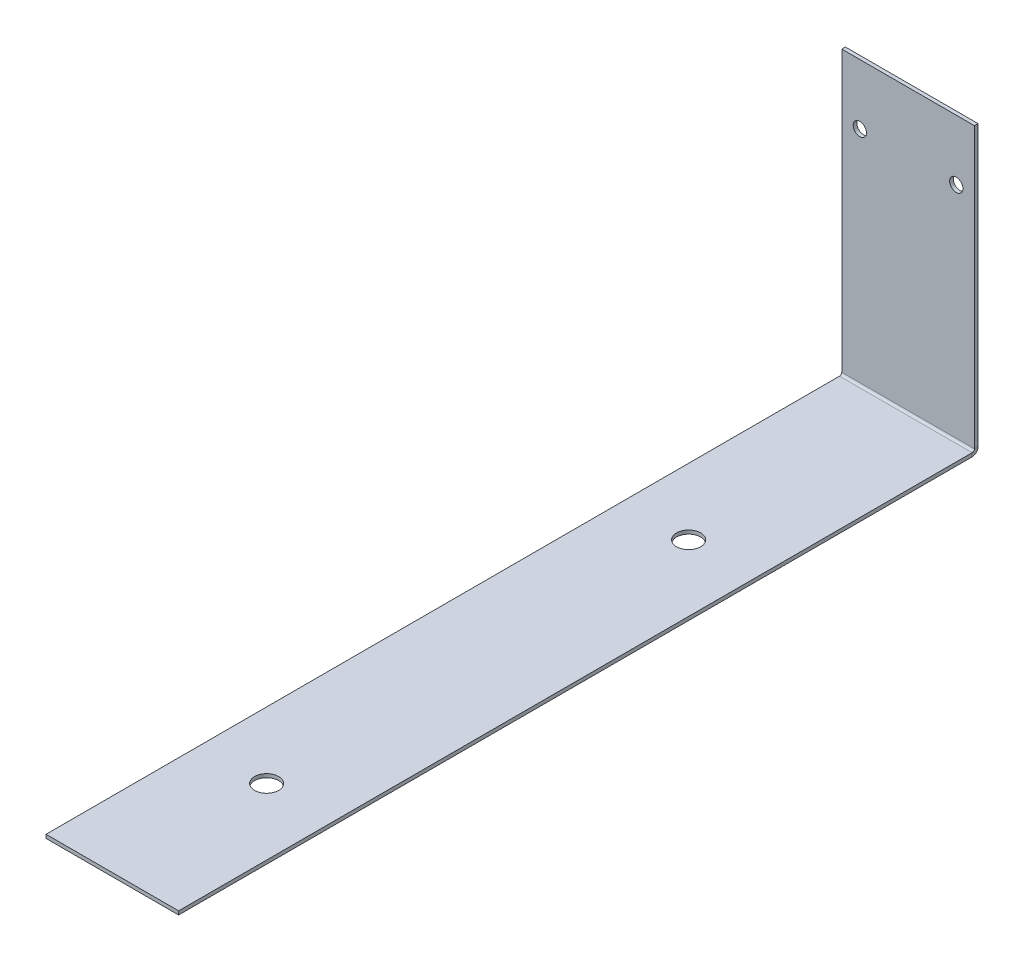
from build123d import *

# Parameters (mm, degrees)
SKETCH1_W              = 44
SKETCH1_H              = 360
BASE_FLANGE1_DEPTH     = 1.2
SKETCHED_START         = -22
SKETCHED_BEND1_DEPTH   = 44
SKETCHED_BEND1_2_DEPTH = 44
SKETCH7_R              = 2.205641569
CUT_EXTRUDE1_DEPTH     = 10
SKETCH8_R              = 4
CUT_EXTRUDE2_DEPTH     = 10


# Read off the part's stored shape, not the designer's step: Sketched Bend1
# Sheet-metal steps are written as plain solids
with BuildPart() as part:
    # Sketch1 → Base-Flange1 (new body)
    with BuildSketch(Plane(origin=(0, 0, 0), x_dir=(1, 0, 0), z_dir=(0, 1, 0))):
        Rectangle(SKETCH1_W, SKETCH1_H)
    extrude(amount=-BASE_FLANGE1_DEPTH)

    # Sketched Bend1 outline → Sketched Bend1 (cut)
    with BuildSketch(Plane.YZ.offset(SKETCHED_START)):
        with BuildLine():
            Line((0, -180), (0, -85.054444388))
            ThreePointArc((0, -85.054444388), (-0.872269031, -84.341342484), (-1.2, -83.2634))
            Line((-1.2, -83.2634), (-1.2, -180))
            Line((-1.2, -180), (0, -180))
        make_face()
    extrude(amount=SKETCHED_BEND1_DEPTH, mode=Mode.SUBTRACT)

    # Sketched Bend1 2 outline → Sketched Bend1 2 (add)
    with BuildSketch(Plane.YZ.offset(SKETCHED_START)):
        with BuildLine():
            Line((93.6, -84), (0.7366, -84))
            ThreePointArc((0.7366, -84), (0.215745145, -83.784254855), (0, -83.2634))
            Line((0, -83.2634), (0, -85.054444388))
            ThreePointArc((0, -85.054444388), (0.361178238, -85.163262642), (0.7366, -85.2))
            Line((0.7366, -85.2), (93.6, -85.2))
            Line((93.6, -85.2), (93.6, -84))
        make_face()
    extrude(amount=SKETCHED_BEND1_2_DEPTH)

    # Sketch7 → Cut-Extrude1 (cut)
    with BuildSketch(Plane(origin=(0, 0, -85.2), x_dir=(-1, 0, 0), z_dir=(0, 0, -1))):
        with Locations(Location((-16, 73.6, 0), (0, 0, 90))):
            Circle(SKETCH7_R)
        with Locations(Location((16, 73.6, 0), (0, 0, 90))):
            Circle(SKETCH7_R)
    extrude(amount=-CUT_EXTRUDE1_DEPTH, mode=Mode.SUBTRACT)

    # Sketch8 → Cut-Extrude2 (cut)
    with BuildSketch(Plane.XZ.offset(1.2)):
        with Locations(Location((0, -11.2, 0), (0, 0, 270))):
            Circle(SKETCH8_R)
        with Locations(Location((0, 128.8, 0), (0, 0, 270))):
            Circle(SKETCH8_R)
    extrude(amount=-CUT_EXTRUDE2_DEPTH, mode=Mode.SUBTRACT)


solid = part.part
